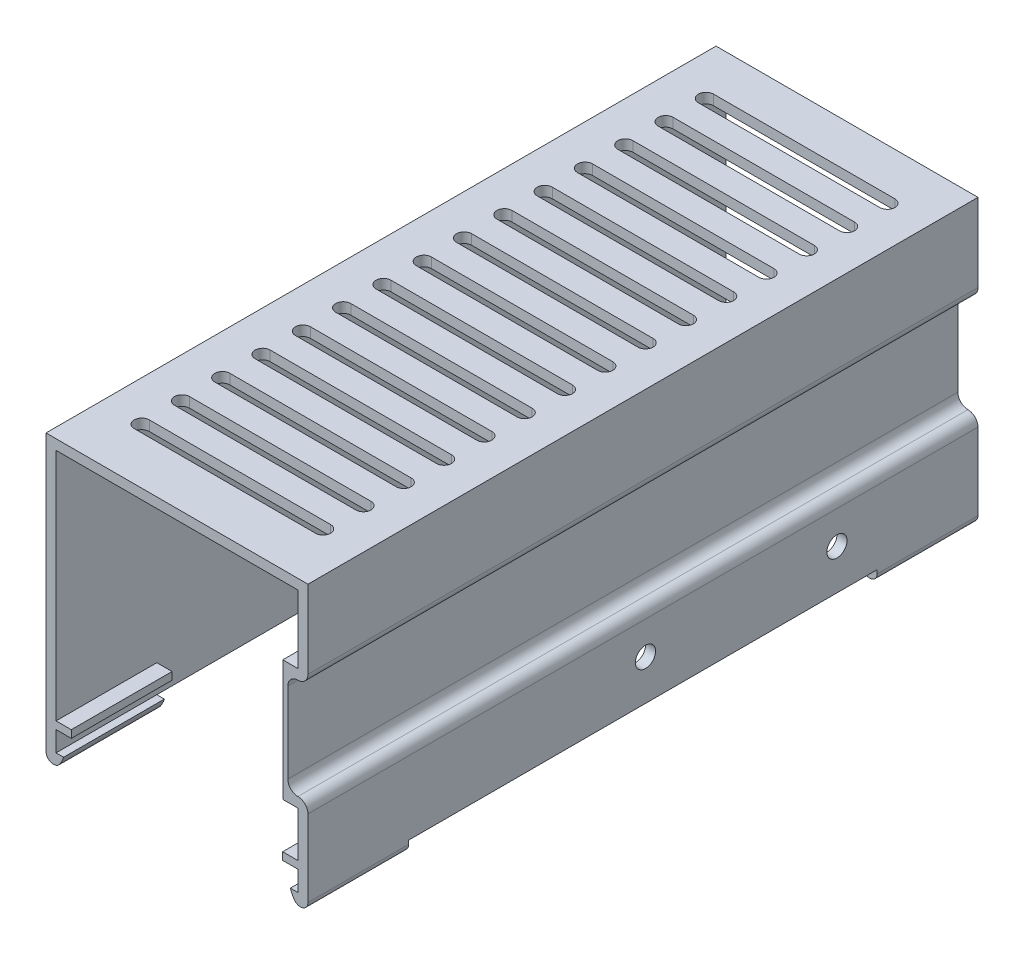
from build123d import *

# Parameters (mm, degrees)
BOSS_EXTRUDE1_DEPTH     = 133
CUT_EXTRUDE2_DEPTH      = 1.5
CUT_EXTRUDE3_DEPTH      = 2
LPATTERN1_COUNT         = 15
LPATTERN1_PITCH         = 8
FILLET2_R               = 2
BOSS_EXTRUDE2_DEPTH     = 20
MIRROR4_COPY_1_DEPTH    = 20
FILLET3_R               = 1.5
SKETCH10_W              = 20
SKETCH10_H              = 1.5
BOSS_EXTRUDE3_DEPTH     = 3.020454194
MIRROR6_COPY_1_SKETCH_W = 20
MIRROR6_COPY_1_SKETCH_H = 1.5
MIRROR6_COPY_1_DEPTH    = 3.020454194
SKETCH11_R              = 2
CUT_EXTRUDE5_DEPTH      = 153.672852981


with BuildPart() as part:
    # Sketch1 → Boss-Extrude1 (new body)
    with BuildSketch(Plane.XY):
        Polygon((0, 0), (0, 54), (52, 54), (52, 36.5), (48, 36.5), (48, 16.5), (52, 16.5), (52, 0), (50, 0), (50, 14.5), (47, 14.5), (47, 38.5), (50, 38.5), (50, 52), (2, 52), (2, 0), align=None)
    extrude(amount=BOSS_EXTRUDE1_DEPTH)

    # Sketch6 → Cut-Extrude2 (cut)
    # profile 1 of 4: a face of its own
    with BuildSketch(Plane.ZY):
        Polygon((18.909019032, 37.199528957), (20.675876003, 37.199528957), (24.40421134, 23.228765736), (29.949013022, 37.199528957), (30.197059897, 37.199528957), (35.638826724, 23.32416838), (39.38624259, 37.199528957), (41.134019032, 37.199528957), (35.997540667, 18.149528957), (35.753309897, 18.149528957), (30.021519032, 32.719420784), (24.221038263, 18.149528957), (23.976807494, 18.149528957), align=None)
    # profile 2 of 4: a face of its own
    with BuildSketch(Plane.ZY):
        Polygon((52.368634417, 37.199528957), (61.160942109, 18.149528957), (59.302498599, 18.149528957), (56.486212542, 24.255298188), (47.850365186, 24.255298188), (44.953940907, 18.149528957), (43.087865186, 18.149528957), (52.124403647, 37.199528957), align=None)
        Polygon((52.227438503, 33.486458044), (48.777678888, 26.209144342), (55.58561158, 26.209144342), align=None, mode=Mode.SUBTRACT)
    # profile 3 of 4: a face of its own
    with BuildSketch(Plane.ZY):
        Polygon((63.236903647, 37.199528957), (65.20983033, 37.199528957), (70.197480571, 29.407040977), (75.185130811, 37.199528957), (77.158057494, 37.199528957), (71.185851965, 27.865334246), (77.402288263, 18.149528957), (75.42936158, 18.149528957), (70.197480571, 26.323627515), (64.965599561, 18.149528957), (62.992672878, 18.149528957), (69.212925282, 27.865334246), align=None)
    # profile 4 of 4: a face of its own
    with BuildSketch(Plane.ZY):
        with BuildLine():
            add(Edge.make_bspline(
                [(89.613826724, 37.687990496), (89.966567987, 37.679056158), (90.659380928, 37.661508382), (91.677602871, 37.527183547), (92.649670462, 37.294798638), (93.583502217, 36.985301548), (94.467928275, 36.572436965), (95.309605676, 36.0734078), (96.106531803, 35.482985932), (96.847965323, 34.805735426), (97.526455295, 34.068862627), (98.124221905, 33.282490002), (98.62519496, 32.451372235), (99.036597602, 31.578006857), (99.359351463, 30.664369031), (99.582067973, 29.705587959), (99.72433419, 28.707875831), (99.74096635, 28.027372468), (99.749403647, 27.682161169)],
                knots=[0, 0, 0, 0, 1.065120563, 2.091984664, 3.0946048, 4.079830382, 5.057816894, 6.036188127, 7.030412546, 8.04752943, 9.064399622, 10.05169764, 11.02544977, 11.989514704, 12.962713494, 13.945757189, 14.957906945, 16, 16, 16, 16], degree=3))
            add(Edge.make_bspline(
                [(99.749403647, 27.682161169), (99.740967586, 27.339492782), (99.724339132, 26.664053694), (99.581906214, 25.672672948), (99.358525914, 24.7196793), (99.039594808, 23.806663675), (98.630153276, 22.932662935), (98.125844416, 22.099976801), (97.531804397, 21.308332288), (96.855764251, 20.566401925), (96.118795722, 19.886058548), (95.328328127, 19.293228668), (94.502138772, 18.783101647), (93.629595931, 18.376064793), (92.722271445, 18.050734769), (91.772044801, 17.828924025), (90.783368557, 17.685847404), (90.109156379, 17.669418053), (89.766470955, 17.661067419)],
                knots=[0, 0, 0, 0, 1.043624062, 2.057103931, 3.04512605, 4.022047818, 4.998200453, 5.980619268, 6.982898556, 8.009068085, 9.034988726, 10.034168286, 11.015286542, 11.987931943, 12.962482838, 13.94673481, 14.956375938, 16, 16, 16, 16], degree=3))
            add(Edge.make_bspline(
                [(89.766470955, 17.661067419), (89.421261448, 17.66950051), (88.740761615, 17.686124378), (87.741795751, 17.828626024), (86.782341174, 18.051463692), (85.865141634, 18.369922195), (84.98968566, 18.781495979), (84.154261067, 19.283351242), (83.362221137, 19.878838682), (82.620132488, 20.55465961), (81.941140424, 21.290379057), (81.349178679, 22.078691217), (80.847210562, 22.904130202), (80.43701871, 23.768986726), (80.112273581, 24.669079864), (79.890723071, 25.61041372), (79.747380246, 26.587621602), (79.73086201, 27.252972234), (79.722480571, 27.59057463)],
                knots=[0, 0, 0, 0, 1.053102029, 2.075944431, 3.073151272, 4.055350789, 5.033113405, 6.020478099, 7.024410459, 8.052272461, 9.079885166, 10.07527673, 11.055994387, 12.023226415, 12.992069828, 13.970394897, 14.97016774, 16, 16, 16, 16], degree=3))
            add(Edge.make_bspline(
                [(79.722480571, 27.59057463), (79.725390515, 27.817175301), (79.731173694, 28.267517973), (79.800797049, 28.936263325), (79.901825737, 29.594253906), (80.046616147, 30.239618637), (80.23598222, 30.870777711), (80.45942254, 31.492084005), (80.732326556, 32.09724113), (81.040831226, 32.689115877), (81.38515621, 33.258481764), (81.765479932, 33.79666921), (82.168443866, 34.308194349), (82.610204622, 34.779801613), (83.076202703, 35.225210514), (83.573997589, 35.63757616), (84.100551805, 36.020616964), (84.658131044, 36.365804821), (85.232996226, 36.678002396), (85.825596973, 36.945909899), (86.427884884, 37.175849177), (87.042680896, 37.362217097), (87.668352413, 37.509348607), (88.306264983, 37.609537204), (88.955910403, 37.679338134), (89.393577725, 37.685093966), (89.613826724, 37.687990496)],
                knots=[0, 0, 0, 0, 1.037015668, 2.060948919, 3.074880161, 4.083647147, 5.086022904, 6.090072063, 7.104153813, 8.122640571, 9.144368836, 10.147691507, 11.138137339, 12.123020368, 13.103399296, 14.087645067, 15.080126199, 16.082011238, 17.087798457, 18.072939717, 19.057185487, 20.037253025, 21.01195951, 21.997135196, 22.992090687, 24, 24, 24, 24], degree=3))
        make_face()
        with BuildLine():
            add(Edge.make_bspline(
                [(89.697781051, 35.734144342), (89.516998546, 35.731940582), (89.157161828, 35.727554131), (88.622213138, 35.669774307), (88.094299898, 35.587424483), (87.573313084, 35.469959349), (87.061432566, 35.30991729), (86.553887002, 35.125726061), (86.055304666, 34.901365554), (85.567331525, 34.647876977), (85.094265188, 34.367303565), (84.64788177, 34.057214376), (84.227025665, 33.724881388), (83.832727313, 33.369529016), (83.466144505, 32.989347612), (83.120062058, 32.590100781), (82.808351907, 32.160376917), (82.52268041, 31.711828845), (82.267041165, 31.24504081), (82.039718306, 30.764927131), (81.853768487, 30.267571436), (81.702117553, 29.758369521), (81.576388582, 29.238127848), (81.496738224, 28.702899871), (81.438323525, 28.155375047), (81.434187795, 27.785359527), (81.432095955, 27.598206842)],
                knots=[0, 0, 0, 0, 1.008559885, 2.007477868, 2.99961109, 3.989939068, 4.984837346, 5.991145699, 7.001802488, 8.033829008, 9.059044045, 10.069351652, 11.065060232, 12.050310815, 13.029377138, 14.011219647, 14.996725999, 15.989392538, 16.977580475, 17.965360261, 18.951710183, 19.937753436, 20.929683414, 21.935841486, 22.955955122, 24, 24, 24, 24], degree=3))
            add(Edge.make_bspline(
                [(81.432095955, 27.598206842), (81.439034847, 27.323003897), (81.452685793, 26.781594568), (81.57219771, 25.988199385), (81.756285886, 25.225718855), (82.027652409, 24.498325035), (82.367017897, 23.799765438), (82.786264257, 23.13623704), (83.282974423, 22.507560509), (83.847200189, 21.918124831), (84.463999492, 21.380121239), (85.11895335, 20.907880401), (85.805045128, 20.508318898), (86.524063989, 20.182808433), (87.272171308, 19.92487286), (88.054187693, 19.748096311), (88.864903766, 19.631752761), (89.417520618, 19.620579903), (89.697781051, 19.614913573)],
                knots=[0, 0, 0, 0, 1.032063989, 2.030389145, 3.003944642, 3.970395727, 4.937377036, 5.913328081, 6.909231446, 7.93887556, 8.970685674, 9.976071282, 10.964166581, 11.944589148, 12.933237628, 13.927779006, 14.949070134, 16, 16, 16, 16], degree=3))
            add(Edge.make_bspline(
                [(89.697781051, 19.614913573), (89.886155624, 19.617501675), (90.25975898, 19.622634659), (90.815450323, 19.6743346), (91.361130561, 19.75723949), (91.896034313, 19.876604915), (92.4195545, 20.025996139), (92.933876214, 20.203475344), (93.433521195, 20.424897324), (93.924792598, 20.669542603), (94.395034999, 20.948435461), (94.843937539, 21.248000247), (95.260185372, 21.579843739), (95.654188746, 21.929916405), (96.022276597, 22.305276777), (96.361959782, 22.705436841), (96.672094501, 23.132922418), (96.957657521, 23.580790127), (97.212400994, 24.048855445), (97.434355804, 24.530709835), (97.62265752, 25.025166787), (97.774668382, 25.532939484), (97.893787824, 26.053063532), (97.975865674, 26.586235357), (98.033279318, 27.13138835), (98.03760681, 27.50010848), (98.039788263, 27.685977275)],
                knots=[0, 0, 0, 0, 1.047197238, 2.076906641, 3.100256066, 4.114471768, 5.12198147, 6.126382909, 7.136867548, 8.15857795, 9.17633901, 10.174870724, 11.156907918, 12.133735059, 13.104061851, 14.077631395, 15.04955518, 16.038496417, 17.029181396, 18.010275684, 18.986308667, 19.968651475, 20.955262928, 21.950658345, 22.966943676, 24, 24, 24, 24], degree=3))
            add(Edge.make_bspline(
                [(98.039788263, 27.685977275), (98.037605062, 27.870574519), (98.033274282, 28.236757158), (97.975893098, 28.778108184), (97.893701109, 29.30744352), (97.775249798, 29.822685077), (97.622576819, 30.323964192), (97.434322921, 30.810810061), (97.212334362, 31.28503638), (96.957563884, 31.745471054), (96.671183473, 32.187293556), (96.35825052, 32.609672402), (96.013361982, 33.004675465), (95.646371761, 33.3820543), (95.248113085, 33.733760242), (94.820389999, 34.059909962), (94.368395124, 34.368374497), (93.889819743, 34.646643627), (93.395913366, 34.903623951), (92.889107395, 35.123792982), (92.375143296, 35.310875517), (91.855328056, 35.47044357), (91.325286416, 35.58696442), (90.788599862, 35.66984852), (90.246010912, 35.72753402), (89.881104245, 35.731933909), (89.697781051, 35.734144342)],
                knots=[0, 0, 0, 0, 1.02996197, 2.043119294, 3.035359645, 4.018872909, 4.991431989, 5.957985074, 6.929999688, 7.912076566, 8.892894881, 9.867085534, 10.843653904, 11.817741046, 12.803660682, 13.806313499, 14.818574707, 15.856120519, 16.894564902, 17.924820532, 18.937903209, 19.946497019, 20.957711757, 21.963978472, 22.977135795, 24, 24, 24, 24], degree=3))
        make_face(mode=Mode.SUBTRACT)
    extrude(amount=-CUT_EXTRUDE2_DEPTH, mode=Mode.SUBTRACT)

    # Sketch7 → Cut-Extrude3 (cut)
    with BuildSketch(Plane(origin=(0, 54, 0), x_dir=(1, 0, 0), z_dir=(0, 1, 0))):
        with BuildLine():
            Line((8, -8.5), (44, -8.5))
            ThreePointArc((44, -8.5), (45.5, -10), (44, -11.5))
            Line((44, -11.5), (8, -11.5))
            ThreePointArc((8, -11.5), (6.5, -10), (8, -8.5))
        make_face()
    cut_extrude3 = extrude(amount=-CUT_EXTRUDE3_DEPTH, mode=Mode.SUBTRACT)

    # LPattern1: Cut-Extrude3 ×15
    with Locations(*[(0, 0, i * LPATTERN1_PITCH) for i in range(1, LPATTERN1_COUNT)]):
        add(cut_extrude3, mode=Mode.SUBTRACT)

    # Fillet2
    fillet2_edges = [part.edges().sort_by_distance(p)[0] for p in [
        (48, 16.5, 66.5),
        (48, 36.5, 66.5),
        (52, 36.5, 66.5),
        (52, 16.5, 66.5),
    ]]
    fillet(fillet2_edges, radius=FILLET2_R - 0.0001)  # a hair under: the kernel refuses the full size

    # Sketch9 → Boss-Extrude2 (add)
    with BuildSketch(Plane.XY.offset(133)):
        with BuildLine():
            Line((52, 0), (48.5, 0))
            ThreePointArc((48.5, 0), (49.850169409, -2.349851767), (52, -4))
            Line((52, -4), (52, 0))
        make_face()
    boss_extrude2 = extrude(amount=-BOSS_EXTRUDE2_DEPTH)

    # Mirror3: Boss-Extrude2 across plane
    add(boss_extrude2.mirror(Plane.XY.offset(66.5)))

    # Mirror4: Boss-Extrude2 across plane
    add(boss_extrude2.mirror(Plane(origin=(26, 0, 0), x_dir=(0, 0, 1), z_dir=(1, 0, 0))))

    # Mirror4 copy 1 sketch → Mirror4 copy 1 (add)
    with BuildSketch(Plane(origin=(52, 0, 0), x_dir=(-1, 0, 0), z_dir=(0, 0, -1))):
        with BuildLine():
            Line((52, 0), (48.5, 0))
            ThreePointArc((48.5, 0), (49.850169409, -2.349851767), (52, -4))
            Line((52, -4), (52, 0))
        make_face()
    extrude(amount=-MIRROR4_COPY_1_DEPTH)

    # Fillet3
    fillet3_edges = [part.edges().sort_by_distance(p)[0] for p in [
        (52, -4, 123),
        (52, -4, 10),
        (0, -4, 10),
        (0, -4, 123),
    ]]
    fillet(fillet3_edges, radius=FILLET3_R)

    # Sketch10 → Boss-Extrude3 (add)
    with BuildSketch(Plane.ZY.offset(-50)):
        with Locations((10, 4.75)):
            Rectangle(SKETCH10_W, SKETCH10_H)
    boss_extrude3 = extrude(amount=BOSS_EXTRUDE3_DEPTH)

    # Mirror5: Boss-Extrude3 across plane
    add(boss_extrude3.mirror(Plane.XY.offset(66.5)))

    # Mirror6: Boss-Extrude3 across plane
    add(boss_extrude3.mirror(Plane(origin=(26, 0, 0), x_dir=(0, 0, 1), z_dir=(1, 0, 0))))

    # Mirror6 copy 1 sketch → Mirror6 copy 1 (add)
    with BuildSketch(Plane(origin=(2, 0, 133), x_dir=(0, 0, -1), z_dir=(1, 0, 0))):
        with Locations((10, 4.75)):
            Rectangle(MIRROR6_COPY_1_SKETCH_W, MIRROR6_COPY_1_SKETCH_H)
    extrude(amount=MIRROR6_COPY_1_DEPTH)

    # Sketch11 → Cut-Extrude5 (cut, through all)
    with BuildSketch(Plane.ZY):
        with Locations((28, 8)):
            Circle(SKETCH11_R)
        with Locations((66, 8)):
            Circle(SKETCH11_R)
    extrude(amount=-CUT_EXTRUDE5_DEPTH, mode=Mode.SUBTRACT)


solid = part.part
